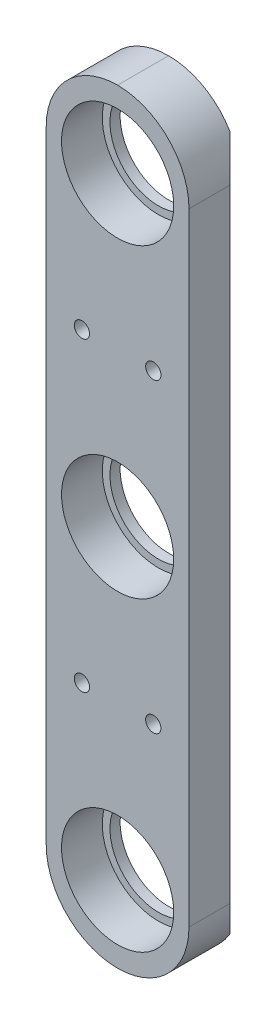
from build123d import *

# Parameters (mm, degrees)
CROQUIS1_W              = 150
CROQUIS1_H              = 28
CROQUIS1_R              = 11
SALIENTE_EXTRUIR1_DEPTH = 10
CROQUIS2_W              = 150
CROQUIS2_H              = 28
CROQUIS2_R              = 9.5
SALIENTE_EXTRUIR2_DEPTH = 2
CHAFL_N1_SIZE           = 2
REDONDEO1_R             = 14
CORTAR_EXTRUIR1_REACH   = 78.948
CROQUIS3_R              = 1.5


with BuildPart() as part:
    # Croquis1 → Saliente-Extruir1 (new body)
    with BuildSketch(Plane(origin=(0, 0, 0), x_dir=(0, 1, 0), z_dir=(0, 0, 1))):
        Rectangle(CROQUIS1_W, CROQUIS1_H)
        with Locations(Location((0, 0, 0), (0, 0, 270))):
            Circle(CROQUIS1_R, mode=Mode.SUBTRACT)
        with Locations(Location((60, 0, 0), (0, 0, 270))):
            Circle(CROQUIS1_R, mode=Mode.SUBTRACT)
        with Locations(Location((-60, 0, 0), (0, 0, 270))):
            Circle(CROQUIS1_R, mode=Mode.SUBTRACT)
    extrude(amount=SALIENTE_EXTRUIR1_DEPTH)

    # Croquis2 → Saliente-Extruir2 (add)
    with BuildSketch(Plane(origin=(0, 0, 0), x_dir=(0, 1, 0), z_dir=(0, 0, 1))):
        Rectangle(CROQUIS2_W, CROQUIS2_H)
        with Locations(Location((0, 0, 0), (0, 0, 270))):
            Circle(CROQUIS2_R, mode=Mode.SUBTRACT)
        with Locations(Location((60, 0, 0), (0, 0, 270))):
            Circle(CROQUIS2_R, mode=Mode.SUBTRACT)
        with Locations(Location((-60, 0, 0), (0, 0, 270))):
            Circle(CROQUIS2_R, mode=Mode.SUBTRACT)
    extrude(amount=SALIENTE_EXTRUIR2_DEPTH)

    # Chaflán1
    chafl_n1_edges = [part.edges().sort_by_distance(p)[0] for p in [
        (14, 0, 0),
    ]]
    chamfer(chafl_n1_edges, length=CHAFL_N1_SIZE)

    # Redondeo1
    redondeo1_edges = [part.edges().sort_by_distance(p)[0] for p in [
        (14, 75, 6),
        (-14, 75, 5),
        (14, -75, 6),
        (-14, -75, 5),
    ]]
    fillet(redondeo1_edges, radius=REDONDEO1_R - 0.0001)  # a hair under: the kernel refuses the full size

    # Croquis3 → Cortar-Extruir1 (cut, up to next)
    with BuildSketch(Plane.XY.offset(10), mode=Mode.PRIVATE) as cortar_extruir1_sk1:
        with Locations((-7, 30)):
            Circle(CROQUIS3_R)
    cortar_extruir1_tool1 = extrude(cortar_extruir1_sk1.sketch, amount=-CORTAR_EXTRUIR1_REACH, mode=Mode.PRIVATE) & part.part
    # Croquis3 → Cortar-Extruir1 (cut, up to next)
    with BuildSketch(Plane.XY.offset(10), mode=Mode.PRIVATE) as cortar_extruir1_sk2:
        with Locations(Location((7, 30, 0), (0, 0, 180))):
            Circle(CROQUIS3_R)
    cortar_extruir1_tool2 = extrude(cortar_extruir1_sk2.sketch, amount=-CORTAR_EXTRUIR1_REACH, mode=Mode.PRIVATE) & part.part
    # Croquis3 → Cortar-Extruir1 (cut, up to next)
    with BuildSketch(Plane.XY.offset(10), mode=Mode.PRIVATE) as cortar_extruir1_sk3:
        with Locations((7, -30)):
            Circle(CROQUIS3_R)
    cortar_extruir1_tool3 = extrude(cortar_extruir1_sk3.sketch, amount=-CORTAR_EXTRUIR1_REACH, mode=Mode.PRIVATE) & part.part
    # Croquis3 → Cortar-Extruir1 (cut, up to next)
    with BuildSketch(Plane.XY.offset(10), mode=Mode.PRIVATE) as cortar_extruir1_sk4:
        with Locations(Location((-7, -30, 0), (0, 0, 180))):
            Circle(CROQUIS3_R)
    cortar_extruir1_tool4 = extrude(cortar_extruir1_sk4.sketch, amount=-CORTAR_EXTRUIR1_REACH, mode=Mode.PRIVATE) & part.part
    add(cortar_extruir1_tool1.solids().sort_by_distance((-7, 30, 10))[0], mode=Mode.SUBTRACT)
    add(cortar_extruir1_tool2.solids().sort_by_distance((7, 30, 10))[0], mode=Mode.SUBTRACT)
    add(cortar_extruir1_tool3.solids().sort_by_distance((7, -30, 10))[0], mode=Mode.SUBTRACT)
    add(cortar_extruir1_tool4.solids().sort_by_distance((-7, -30, 10))[0], mode=Mode.SUBTRACT)


solid = part.part
